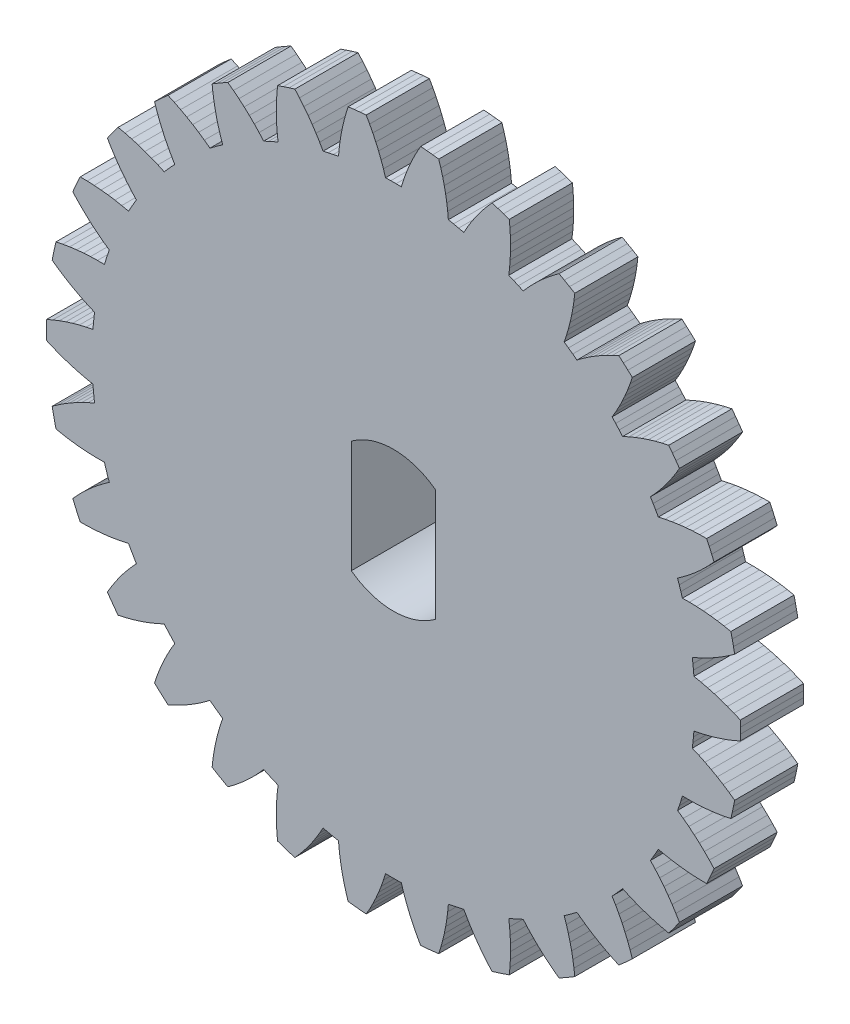
from build123d import *

# Parameters (mm, degrees)
BOSS_EXTRUDE1_DEPTH = 2.25
CUT_EXTRUDE1_REACH  = 33.252
SKETCH4_R           = 3.500002667
BOSS_EXTRUDE2_DEPTH = 3.5


with BuildPart() as part:
    # Sketch2 → Boss-Extrude1 (new body)
    with BuildSketch(Plane.XY):
        Polygon((0.281141132, 27.022846222), (0.355339468, 27.259799957), (0.437802315, 27.494007111), (0.528428257, 27.725175858), (0.627105772, 27.953025818), (0.733713448, 28.177274704), (0.848120153, 28.39764595), (0.970185101, 28.613870621), (1.185179591, 28.595060349), (1.399813175, 28.572502136), (1.614020228, 28.546201706), (1.688462257, 28.309322357), (1.754551053, 28.069980621), (1.812205195, 27.828466415), (1.861353755, 27.5850811), (1.901936412, 27.340120316), (1.933902979, 27.093887329), (1.957214355, 26.846683502), (2.141216993, 26.810916901), (2.324567318, 26.771945953), (2.507209539, 26.72977829), (2.629051915, 26.946127316), (2.758407156, 27.158071491), (2.895115389, 27.365346454), (3.039009235, 27.567701136), (3.189911242, 27.764884664), (3.347635644, 27.956653779), (3.511988817, 28.142774692), (3.718374287, 28.079675601), (3.923627496, 28.012985508), (4.127685444, 27.942723655), (4.15125075, 27.69554332), (4.166133402, 27.447691142), (4.172314036, 27.199467631), (4.169785929, 26.951182309), (4.158551547, 26.703136896), (4.138624851, 26.455638468), (4.110030253, 26.20898993), (4.282575697, 26.135748615), (4.453816861, 26.059508601), (4.623700762, 25.980288949), (4.787862081, 26.166577775), (4.958456272, 26.346995995), (5.135271989, 26.521318262), (5.318093314, 26.689333797), (5.506694511, 26.8508341), (5.700843297, 27.005619852), (5.900301673, 27.15350263), (6.089058086, 27.048872454), (6.27596037, 26.940965159), (6.460950902, 26.829812662), (6.432609568, 26.583134308), (6.395635633, 26.337604018), (6.350072635, 26.09351976), (6.295978353, 25.851185691), (6.233417927, 25.610896425), (6.162468861, 25.372949424), (6.083218008, 25.1376359), (6.236765195, 25.030120868), (6.388413139, 24.919943841), (6.538113977, 24.807134479), (6.737419602, 24.955221391), (6.941796958, 25.096228513), (7.150992465, 25.229979365), (7.364751099, 25.356312667), (7.582808708, 25.475071407), (7.804896645, 25.586108917), (8.030742935, 25.689290373), (8.193620731, 25.547701953), (8.354003563, 25.40329352), (8.511841705, 25.256108278), (8.432832383, 25.020712933), (8.3456178, 24.788235382), (8.250302492, 24.55895803), (8.147006213, 24.333166376), (8.035853936, 24.11113505), (7.916983314, 23.893138903), (7.79053985, 23.679444723), (7.91837803, 23.542354897), (8.04380501, 23.403056122), (8.16678014, 23.261587361), (8.39251946, 23.365000249), (8.621747709, 23.460433585), (8.854180158, 23.547767469), (9.089533824, 23.626897166), (9.327517681, 23.697724017), (9.567838461, 23.760160412), (9.810202098, 23.814131022), (9.940082735, 23.64177245), (10.066936617, 23.467174223), (10.190724084, 23.290388937), (10.064499861, 23.076564506), (9.930856325, 22.867300078), (9.789954444, 22.662850154), (9.641970712, 22.463469093), (9.48708447, 22.269399543), (9.325487508, 22.080881726), (9.157377619, 21.898146351), (9.253919651, 21.737473215), (9.347643907, 21.575140716), (9.438518726, 21.41119542), (9.680825848, 21.465414644), (9.924886617, 21.5111033), (10.170397595, 21.548203306), (10.417060207, 21.576671051), (10.664569277, 21.596470538), (10.912619727, 21.607577049), (11.160908258, 21.609978038), (11.25211533, 21.414382212), (11.339896137, 21.217224969), (11.424222823, 21.018566005), (11.256300304, 20.835657642), (11.082068678, 20.658752198), (10.901738311, 20.488065143), (10.715534726, 20.323808585), (10.523683791, 20.16618258), (10.326423053, 20.015382228), (10.123993948, 19.87159207), (10.185020481, 19.694357811), (10.242945813, 19.516086298), (10.297748656, 19.336829663), (10.546033596, 19.339485583), (10.794260257, 19.333432746), (11.042119756, 19.318677425), (11.289310975, 19.29523904), (11.535527923, 19.263145832), (11.780467049, 19.22243705), (12.023829074, 19.173163484), (12.072376393, 18.962878879), (12.117247684, 18.75177934), (12.158428108, 18.539929046), (11.956146312, 18.395930725), (11.748941355, 18.259115881), (11.537063805, 18.129651539), (11.320778356, 18.007698283), (11.100347536, 17.893404837), (10.876044262, 17.786912648), (10.648143063, 17.688352028), (10.670986946, 17.502302632), (10.690581739, 17.315883426), (10.706917458, 17.129149827), (10.950328974, 17.080126367), (11.19187283, 17.022596574), (11.431248201, 16.956630805), (11.668164585, 16.882310661), (11.902328548, 16.799727384), (12.133451335, 16.708982479), (12.361250766, 16.610187848), (12.365016582, 16.394404912), (12.365017264, 16.178589137), (12.361251645, 15.962806389), (12.133451257, 15.864011527), (11.90232882, 15.773266749), (11.668164153, 15.690683333), (11.431249552, 15.616363322), (11.191872731, 15.550397607), (10.95033005, 15.4928678), (10.706917134, 15.44384429), (10.690579979, 15.257111009), (10.670987846, 15.070691524), (10.648142492, 14.884642115), (10.876042332, 14.786081836), (11.100346759, 14.679589415), (11.320776149, 14.565296217), (11.537063315, 14.443342461), (11.748940205, 14.313878402), (11.956145478, 14.177063361), (12.158426386, 14.033065465), (12.117246114, 13.821214946), (12.07237616, 13.610115123), (12.023829072, 13.399830662), (11.780466062, 13.350557068), (11.535527305, 13.309848338), (11.28930964, 13.27775514), (11.042120192, 13.254316514), (10.794259285, 13.239561547), (10.546033773, 13.233508452), (10.297747452, 13.236164614), (10.24294327, 13.05690859), (10.185020482, 12.878636251), (10.123992507, 12.701402283), (10.326420355, 12.557612742), (10.523682173, 12.406811923), (10.71553176, 12.249186459), (10.90173692, 12.084929055), (11.082066701, 11.914242414), (11.256298594, 11.737336711), (11.424220333, 11.554428949), (11.33989375, 11.355769732), (11.25211419, 11.158611934), (11.160907375, 10.9630162), (10.912617874, 10.965417368), (10.664567796, 10.976523852), (10.417058027, 10.996323498), (10.170397097, 11.024790639), (9.924884815, 11.061891284), (9.680825117, 11.10757945), (9.438516695, 11.161799197), (9.347640693, 10.997854777), (9.253918754, 10.835520941), (9.157375372, 10.674848391), (9.325484159, 10.492113879), (9.48708208, 10.303595382), (9.641967116, 10.109526641), (9.789952212, 9.910144425), (9.930853606, 9.705695027), (10.064497351, 9.496430291), (10.190720935, 9.28260661), (10.066933516, 9.105821056), (9.940080739, 8.931222026), (9.810200372, 8.758863491), (9.567835824, 8.812834477), (9.327515403, 8.875270769), (9.089530894, 8.94609792), (8.854178748, 9.025226676), (8.621745157, 9.112561457), (8.392517852, 9.207994091), (8.16677737, 9.31140776), (8.043801265, 9.169940102), (7.918376273, 9.030639537), (7.790536894, 8.893550565), (7.916979459, 8.67985746), (8.035850878, 8.461860447), (8.147002145, 8.239830163), (8.250299518, 8.014037096), (8.345614459, 7.78476036), (8.432829182, 7.552282464), (8.511838035, 7.316887985), (8.353999884, 7.169702471), (8.193617966, 7.025293023), (8.030740441, 6.883704583), (7.804893339, 6.986886597), (7.582805731, 7.097923931), (7.364747547, 7.216683101), (7.150990204, 7.343015166), (6.941793767, 7.476767133), (6.737417189, 7.617773372), (6.538110588, 7.76586129), (6.388409027, 7.653053209), (6.236762655, 7.542874018), (6.083214474, 7.43536007), (6.16246467, 7.200047784), (6.233414336, 6.962099772), (6.29597399, 6.721811735), (6.350069049, 6.479476056), (6.395631815, 6.235392477), (6.432605816, 5.989861819), (6.460946871, 5.74318441), (6.275956274, 5.632031649), (6.089054672, 5.524123171), (5.900298521, 5.419492919), (5.700839466, 5.567376411), (5.506690965, 5.722161924), (5.318089296, 5.883662766), (5.135268977, 6.051676824), (4.958452581, 6.226000374), (4.787858967, 6.406417568), (4.623696903, 6.592707582), (4.453812561, 6.513489334), (4.282572485, 6.437246875), (4.110026293, 6.364006828), (4.138620508, 6.117359637), (4.158547579, 5.869860094), (4.169781462, 5.621816044), (4.172309994, 5.373528986), (4.166129275, 5.125306187), (4.15124661, 4.877453637), (4.127681228, 4.630274284), (3.923623161, 4.560012186), (3.718370374, 4.493320795), (3.511985145, 4.430221576), (3.347631456, 4.616343328), (3.189907283, 4.808112148), (3.039004926, 5.005296302), (2.895111756, 5.207649331), (2.758403127, 5.414925689), (2.629048237, 5.626868741), (2.50720538, 5.843219084), (2.324563018, 5.801052885), (2.14121325, 5.762079321), (1.957210144, 5.726314115), (1.933898672, 5.479111685), (1.901932241, 5.23287753), (1.861349379, 4.987918182), (1.812200874, 4.744531081), (1.754546797, 4.503017589), (1.688457911, 4.263675492), (1.614016012, 4.026797119), (1.399808792, 4.000496474), (1.185175351, 3.977936904), (0.970181069, 3.959126456), (0.848115791, 4.175352055), (0.733709249, 4.395722966), (0.627101361, 4.619972537), (0.528424163, 4.847820739), (0.437798123, 5.078990934), (0.355335386, 5.313196916), (0.281136853, 5.550152038), (0.09371882, 5.546880754), (-0.093727376, 5.546879417), (-0.281145577, 5.550152163), (-0.355343912, 5.313198427), (-0.437806759, 5.078991274), (-0.528432701, 4.847822527), (-0.627110217, 4.619972567), (-0.733717893, 4.395723681), (-0.848124598, 4.175352434), (-0.970189546, 3.959127764), (-1.185184036, 3.977938036), (-1.39981762, 4.000496248), (-1.614024673, 4.026796679), (-1.688466702, 4.263676027), (-1.754555498, 4.503017763), (-1.81220964, 4.744531969), (-1.8613582, 4.987917284), (-1.901940856, 5.232878069), (-1.933907423, 5.479111056), (-1.9572188, 5.726314882), (-2.141221438, 5.762081484), (-2.324571763, 5.801052431), (-2.507213984, 5.843220095), (-2.62905636, 5.626871069), (-2.758411601, 5.414926893), (-2.895119833, 5.207651931), (-3.039013679, 5.005297248), (-3.189915687, 4.80811372), (-3.347640089, 4.616344606), (-3.511993262, 4.430223693), (-3.718378731, 4.493322784), (-3.92363194, 4.560012876), (-4.127689888, 4.63027473), (-4.151255195, 4.877455064), (-4.166137847, 5.125307242), (-4.172318481, 5.373530754), (-4.169790374, 5.621816076), (-4.158555991, 5.869861488), (-4.138629296, 6.117359916), (-4.110034697, 6.364008454), (-4.282580141, 6.437249769), (-4.453821306, 6.513489784), (-4.623705206, 6.592709436), (-4.787866526, 6.406420609), (-4.958460716, 6.22600239), (-5.135276434, 6.051680122), (-5.318097758, 5.883664588), (-5.506698955, 5.722164285), (-5.700847742, 5.567378533), (-5.900306117, 5.419495754), (-6.08906253, 5.52412593), (-6.275964814, 5.632033226), (-6.460955346, 5.743185722), (-6.432614012, 5.989864076), (-6.395640077, 6.235394367), (-6.35007708, 6.479478625), (-6.295982797, 6.721812694), (-6.233422372, 6.96210196), (-6.162473306, 7.200048961), (-6.083222453, 7.435362485), (-6.23676964, 7.542877516), (-6.388417584, 7.653054544), (-6.538118421, 7.765863905), (-6.737424047, 7.617776994), (-6.941801402, 7.476769872), (-7.15099691, 7.343019019), (-7.364755543, 7.216685718), (-7.582813153, 7.097926978), (-7.80490109, 6.986889468), (-8.03074738, 6.883708011), (-8.193625175, 7.025296432), (-8.354008008, 7.169704864), (-8.511846149, 7.316890106), (-8.432836828, 7.552285452), (-8.345622244, 7.784763003), (-8.250306937, 8.014040355), (-8.147010658, 8.239832009), (-8.03585838, 8.461863334), (-7.916987758, 8.679859481), (-7.790544294, 8.893553662), (-7.918382474, 9.030643487), (-8.043809455, 9.169942263), (-8.166784585, 9.311411023), (-8.392523905, 9.207998136), (-8.621752154, 9.112564799), (-8.854184603, 9.025230915), (-9.089538268, 8.946101219), (-9.327522126, 8.875274368), (-9.567842905, 8.812837973), (-9.810206543, 8.758867363), (-9.94008718, 8.931225934), (-10.066941062, 9.105824162), (-10.190728528, 9.282609448), (-10.064504306, 9.496433879), (-9.930860769, 9.705698306), (-9.789958888, 9.910148231), (-9.641975156, 10.109529292), (-9.487088914, 10.303598842), (-9.325491953, 10.492116658), (-9.157382064, 10.674852034), (-9.253924095, 10.83552517), (-9.347648352, 10.997857668), (-9.438523171, 11.161802965), (-9.680830293, 11.10758374), (-9.924891061, 11.061895084), (-10.170402039, 11.024795079), (-10.417064651, 10.996327334), (-10.664573721, 10.976527846), (-10.912624171, 10.965421336), (-11.160912703, 10.963020347), (-11.252119774, 11.158616173), (-11.339900581, 11.355773415), (-11.424227267, 11.55443238), (-11.256304748, 11.737340743), (-11.082073123, 11.914246187), (-10.901742756, 12.084933241), (-10.71553917, 12.2491898), (-10.523688236, 12.406815804), (-10.326427498, 12.557616157), (-10.123998392, 12.701406314), (-10.185024926, 12.878640574), (-10.242950258, 13.056912087), (-10.2977531, 13.236168722), (-10.546038041, 13.233512801), (-10.794264702, 13.239565639), (-11.042124201, 13.25432096), (-11.28931542, 13.277759345), (-11.535532368, 13.309852552), (-11.780471494, 13.350561334), (-12.023833519, 13.399834901), (-12.072380838, 13.610119505), (-12.117252128, 13.821219045), (-12.158432552, 14.033069339), (-11.956150756, 14.17706766), (-11.7489458, 14.313882504), (-11.53706825, 14.443346845), (-11.3207828, 14.565300102), (-11.10035198, 14.679593547), (-10.876048707, 14.786085737), (-10.648147508, 14.884646357), (-10.67099139, 15.070695752), (-10.690586183, 15.257114958), (-10.706921902, 15.443848558), (-10.950333418, 15.492872017), (-11.191877275, 15.550401811), (-11.431252646, 15.61636758), (-11.668169029, 15.690687724), (-11.902332993, 15.773271), (-12.13345578, 15.864015905), (-12.36125521, 15.962810536), (-12.365021026, 16.178593473), (-12.365021709, 16.394409247), (-12.361256089, 16.610191995), (-12.133455701, 16.708986857), (-11.902333265, 16.799731636), (-11.668168598, 16.882315051), (-11.431253996, 16.956635063), (-11.191877175, 17.022600778), (-10.950334495, 17.080130585), (-10.706921579, 17.129154095), (-10.690584423, 17.315887375), (-10.670992291, 17.502306861), (-10.648146937, 17.68835627), (-10.876046777, 17.786916549), (-11.100351204, 17.89340897), (-11.320780594, 18.007702167), (-11.537067759, 18.129655924), (-11.74894465, 18.259119983), (-11.956149923, 18.395935023), (-12.15843083, 18.53993292), (-12.117250559, 18.751783439), (-12.072380604, 18.962883262), (-12.023833516, 19.173167723), (-11.780470507, 19.222441316), (-11.53553175, 19.263150047), (-11.289314085, 19.295243245), (-11.042124637, 19.318681871), (-10.79426373, 19.333436837), (-10.546038217, 19.339489932), (-10.297751896, 19.336833771), (-10.242947715, 19.516089795), (-10.185024927, 19.694362134), (-10.123996952, 19.871596101), (-10.326424799, 20.015385643), (-10.523686617, 20.166186461), (-10.715536204, 20.323811925), (-10.901741364, 20.48806933), (-11.082071145, 20.658755971), (-11.256303039, 20.835661674), (-11.424224777, 21.018569436), (-11.339898194, 21.217228653), (-11.252118634, 21.41438645), (-11.160911819, 21.609982184), (-10.912622319, 21.607581017), (-10.66457224, 21.596474532), (-10.417062471, 21.576674886), (-10.170401541, 21.548207746), (-9.92488926, 21.5111071), (-9.680829561, 21.465418935), (-9.438521139, 21.411199188), (-9.347645138, 21.575143608), (-9.253923198, 21.737477444), (-9.157379817, 21.898149994), (-9.325488603, 22.080884505), (-9.487086524, 22.269403002), (-9.641971561, 22.463471744), (-9.789956657, 22.66285396), (-9.930858051, 22.867303358), (-10.064501796, 23.076568094), (-10.19072538, 23.290391775), (-10.066937961, 23.467177329), (-9.940085184, 23.641776359), (-9.810204817, 23.814134894), (-9.567840268, 23.760163908), (-9.327519847, 23.697727616), (-9.089535338, 23.626900465), (-8.854183193, 23.547771708), (-8.621749602, 23.460436928), (-8.392522297, 23.365004293), (-8.166781814, 23.261590624), (-8.04380571, 23.403058282), (-7.918380717, 23.542358848), (-7.790541339, 23.679447819), (-7.916983904, 23.893140925), (-8.035855323, 24.111137938), (-8.14700659, 24.333168221), (-8.250303963, 24.558961289), (-8.345618903, 24.788238024), (-8.432833627, 25.020715921), (-8.511842479, 25.2561104), (-8.354004329, 25.403295914), (-8.19362241, 25.547705361), (-8.030744886, 25.689293801), (-7.804897784, 25.586111788), (-7.582810175, 25.475074454), (-7.364751992, 25.356315284), (-7.150994649, 25.229983218), (-6.941798211, 25.096231251), (-6.737421633, 24.955225013), (-6.538115033, 24.807137095), (-6.388413471, 24.919945175), (-6.2367671, 25.030124367), (-6.083218918, 25.137638314), (-6.162469115, 25.3729506), (-6.233418781, 25.610898613), (-6.295978434, 25.85118665), (-6.350073493, 26.093522329), (-6.39563626, 26.337605908), (-6.43261026, 26.583136565), (-6.460951315, 26.829813974), (-6.275960718, 26.940966735), (-6.089059117, 27.048875213), (-5.900302965, 27.153505465), (-5.700843911, 27.005621973), (-5.50669541, 26.850836461), (-5.31809374, 26.689335619), (-5.135273422, 26.521321561), (-4.958457026, 26.34699801), (-4.787863412, 26.166580816), (-4.623701348, 25.980290803), (-4.453817006, 26.059509051), (-4.282576929, 26.135751509), (-4.110030738, 26.208991557), (-4.138624952, 26.455638748), (-4.158552024, 26.70313829), (-4.169785907, 26.95118234), (-4.172314438, 27.199469398), (-4.16613372, 27.447692198), (-4.151251055, 27.695544748), (-4.127685673, 27.9427241), (-3.923627606, 28.012986199), (-3.718374819, 28.07967759), (-3.511989589, 28.142776809), (-3.347635901, 27.956655057), (-3.189911728, 27.764886236), (-3.03900937, 27.567702083), (-2.895116201, 27.365349054), (-2.758407572, 27.158072695), (-2.629052681, 26.946129643), (-2.507209825, 26.729779301), (-2.324567463, 26.7719455), (-2.141217695, 26.810919064), (-1.957214589, 26.84668427), (-1.933903117, 27.093886699), (-1.901936686, 27.340120854), (-1.861353823, 27.585080202), (-1.812205318, 27.828467304), (-1.754551241, 28.069980796), (-1.688462356, 28.309322893), (-1.614020457, 28.546201265), (-1.399813237, 28.57250191), (-1.185179795, 28.595061481), (-0.970185513, 28.613871928), (-0.848120235, 28.39764633), (-0.733713693, 28.177275419), (-0.627105805, 27.953025848), (-0.528428607, 27.725177646), (-0.437802568, 27.494007451), (-0.355339831, 27.259801469), (-0.281141298, 27.022846346), (-0.093723264, 27.02611763), (0.093722931, 27.026118968), align=None)
    extrude(amount=BOSS_EXTRUDE1_DEPTH)

    # Sketch3 → Cut-Extrude1 (cut, up to next)
    with BuildSketch(Plane.XY.offset(2.25), mode=Mode.PRIVATE) as cut_extrude1_sk1:
        with BuildLine():
            Line((-1.5, 18.286500859), (-1.5, 14.286497526))
            ThreePointArc((-1.5, 14.286497526), (-4.44e-07, 13.786499192), (1.5, 14.286497526))
            Line((1.5, 14.286497526), (1.5, 18.286500859))
            ThreePointArc((1.5, 18.286500859), (-4.44e-07, 18.786501859), (-1.5, 18.286500859))
        make_face()
    cut_extrude1_tool1 = extrude(cut_extrude1_sk1.sketch, amount=-CUT_EXTRUDE1_REACH, mode=Mode.PRIVATE) & part.part
    add(cut_extrude1_tool1.solids().sort_by_distance((0, 16.2865, 2.25))[0], mode=Mode.SUBTRACT)


with BuildPart() as boss_extrude2_tool:
    # Sketch4 → Boss-Extrude2 (new body)
    with BuildSketch(Plane(origin=(0, 0, 0), x_dir=(-1, 0, 0), z_dir=(0, 0, -1))):
        with Locations(Location((2.222e-06, 16.286499192, 0), (0, 0, 180))):
            Circle(SKETCH4_R)
        with BuildLine():
            Line((-1.5, 18.286500859), (-1.5, 14.286497526))
            ThreePointArc((-1.5, 14.286497526), (1.24e-07, 13.786496526), (1.5, 14.286496459))
            Line((1.5, 14.286496459), (1.5, 18.286500859))
            ThreePointArc((1.5, 18.286500859), (4.44e-07, 18.786499192), (-1.5, 18.286500859))
        make_face(mode=Mode.SUBTRACT)
    extrude(amount=BOSS_EXTRUDE2_DEPTH)


with BuildPart() as part_1:
    add(part.part)


with BuildPart() as part_2:
    # Boss-Extrude2: joined with boss_extrude2_tool
    add(part_1.part.fuse(boss_extrude2_tool.part, tol=0.00001))


solid = part_2.part
